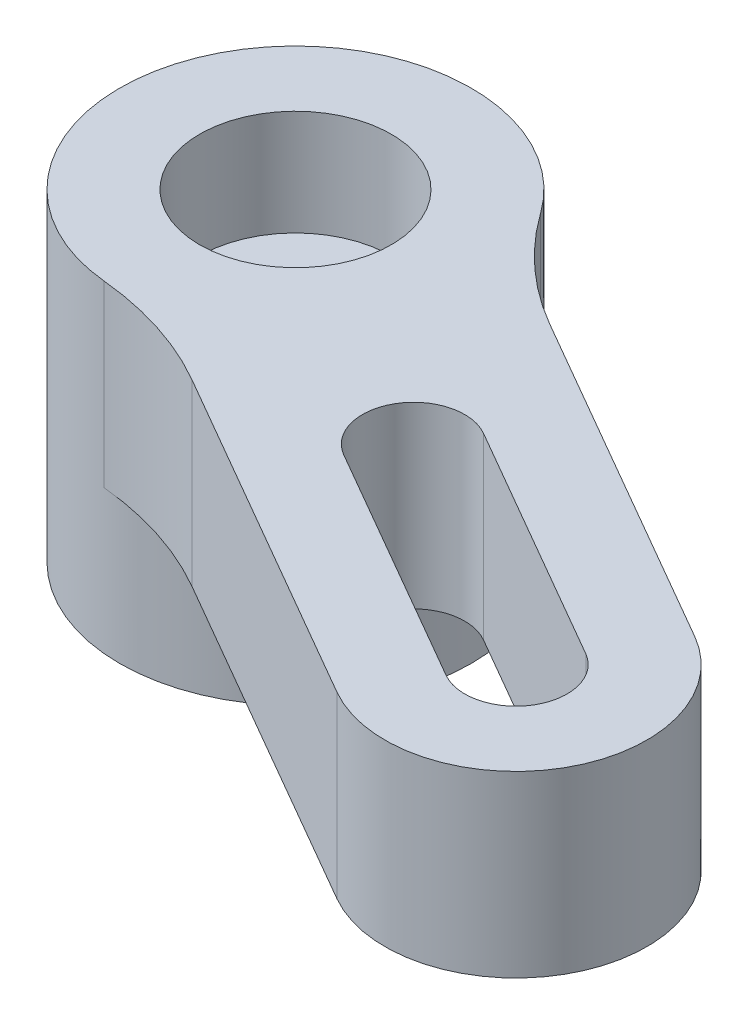
from build123d import *

# Parameters (mm, degrees)
EXTRUDE_THIN2_DEPTH = 5.6
BOSS_EXTRUDE1_DEPTH = 5.6
BOSS_EXTRUDE2_START = -4.5
SKETCH6_R           = 5.5
BOSS_EXTRUDE2_DEPTH = 10.1
FILLET1_R           = 10
SKETCH7_R           = 2.59
CUT_EXTRUDE3_DEPTH  = 4
CUT_EXTRUDE4_DEPTH  = 4
CIRPATTERN1_COUNT   = 25
SKETCH9_R           = 3
CUT_EXTRUDE5_DEPTH  = 3.3
SKETCH10_R          = 1.6
CUT_EXTRUDE6_DEPTH  = 26.423002314


with BuildPart() as part:
    # Sketch4 → Extrude-Thin2 (new body)
    with BuildSketch(Plane(origin=(0, 0, 0), x_dir=(1, 0, 0), z_dir=(0, 1, 0))):
        with BuildLine():
            Line((10.796856578, -1.499295844), (18.374578861, -5.874295844))
            ThreePointArc((18.374578861, -5.874295844), (19.875283017, -11.475), (14.274578861, -12.975704156))
            Line((14.274578861, -12.975704156), (6.696856578, -8.600704156))
            ThreePointArc((6.696856578, -8.600704156), (5.196152423, -3), (10.796856578, -1.499295844))
        make_face()
        with BuildLine():
            Line((9.546856578, -3.664359354), (17.124578861, -8.039359354))
            ThreePointArc((17.124578861, -8.039359354), (17.710219507, -10.225), (15.524578861, -10.810640646))
            Line((15.524578861, -10.810640646), (7.946856578, -6.435640646))
            ThreePointArc((7.946856578, -6.435640646), (7.361215932, -4.25), (9.546856578, -3.664359354))
        make_face(mode=Mode.SUBTRACT)
    extrude(amount=EXTRUDE_THIN2_DEPTH)

    # Sketch5 → Boss-Extrude1 (add)
    with BuildSketch(Plane(origin=(0, 0, 0), x_dir=(1, 0, 0), z_dir=(0, 1, 0))):
        with BuildLine():
            Line((10.796856578, -1.499295844), (2.05, 3.550704156))
            ThreePointArc((2.05, 3.550704156), (-3.550704156, 2.05), (-2.05, -3.550704156))
            Line((-2.05, -3.550704156), (6.696856578, -8.600704156))
            ThreePointArc((6.696856578, -8.600704156), (8.998238507, -9.142286296), (11.216030786, -8.323099255))
            Line((11.216030786, -8.323099255), (7.946856578, -6.435640646))
            ThreePointArc((7.946856578, -6.435640646), (7.361215932, -4.25), (9.546856578, -3.664359354))
            Line((9.546856578, -3.664359354), (12.816030786, -5.551817963))
            ThreePointArc((12.816030786, -5.551817963), (12.416571434, -3.221559989), (10.796856578, -1.499295844))
        make_face()
    extrude(amount=BOSS_EXTRUDE1_DEPTH)

    # Sketch6 → Boss-Extrude2 (add)
    with BuildSketch(Plane(origin=(0, 0, 0), x_dir=(1, 0, 0), z_dir=(0, 1, 0)).offset(BOSS_EXTRUDE2_START)):
        with Locations(Location((0, 0, 0), (0, 0, 270))):
            Circle(SKETCH6_R)
    extrude(amount=BOSS_EXTRUDE2_DEPTH)

    # Fillet1
    # the kernel refuses this fillet: 10 mm, written as the material it adds along each edge
    with BuildSketch(Plane(origin=(1.124901573, 5.6, 5.383734433), x_dir=(-0.998469356889102, 0, 0.05530771513507689), z_dir=(0, -1, 0))) as fillet1_piece_1:
        with BuildLine():
            CenterArc((3.151594855, -9.886744715), FILLET1_R, 98.631327733, 24.539188727)
            Line((-2.319730793, -1.516285011), (0, 0))
            ThreePointArc((0, 0), (0.8254177, -0.062290407), (1.6508354, 0))
        make_face()
    extrude(amount=5.6)
    with BuildSketch(Plane(origin=(5.224901573, 5.6, -1.717673878), x_dir=(0.8660254037844397, 0, 0.49999999999999806), z_dir=(0, -1, 0))) as fillet1_piece_2:
        with BuildLine():
            CenterArc((2.77133022, -10), FILLET1_R, 90, 24.539188727)
            ThreePointArc((-1.381825119, -0.903225806), (-0.65683145, -0.503752837), (0, 0))
            Line((0, 0), (2.77133022, 0))
        make_face()
    extrude(amount=5.6)

    # Sketch7 → Cut-Extrude3 (cut)
    with BuildSketch(Plane.XZ.offset(4.5)):
        with Locations(Location((0, 0, 0), (0, 0, 270))):
            Circle(SKETCH7_R)
    extrude(amount=-CUT_EXTRUDE3_DEPTH, mode=Mode.SUBTRACT)

    # Sketch8 → Cut-Extrude4 (cut)
    with BuildSketch(Plane.XZ.offset(4.5)):
        with BuildLine():
            Line((0, 3.04), (0, 2.59))
            ThreePointArc((0, 2.59), (0.162627446, 2.584889227), (0.324613075, 2.569577076))
            Line((0.324613075, 2.569577076), (0.15, 3.04))
            Line((0.15, 3.04), (0, 3.04))
        make_face()
        with BuildLine():
            ThreePointArc((-0.324613075, 2.569577076), (-0.162627446, 2.584889227), (0, 2.59))
            Line((0, 2.59), (0, 3.04))
            Line((0, 3.04), (-0.15, 3.04))
            Line((-0.15, 3.04), (-0.324613075, 2.569577076))
        make_face()
    cut_extrude4 = extrude(amount=-CUT_EXTRUDE4_DEPTH, mode=Mode.SUBTRACT)

    # CirPattern1: Cut-Extrude4 ×25 about axis
    cirpattern1_axis = Axis((0, 0, 0), (0, 1, 0))
    for i in range(1, CIRPATTERN1_COUNT):
        add(cut_extrude4.rotate(cirpattern1_axis, i * 360 / CIRPATTERN1_COUNT), mode=Mode.SUBTRACT)

    # Sketch9 → Cut-Extrude5 (cut)
    with BuildSketch(Plane(origin=(0, 5.6, 0), x_dir=(1, 0, 0), z_dir=(0, 1, 0))):
        with Locations(Location((0, 0, 0), (0, 0, 270))):
            Circle(SKETCH9_R)
    extrude(amount=-CUT_EXTRUDE5_DEPTH, mode=Mode.SUBTRACT)

    # Sketch10 → Cut-Extrude6 (cut, through all)
    with BuildSketch(Plane(origin=(0, 2.3, 0), x_dir=(1, 0, 0), z_dir=(0, 1, 0))):
        with Locations(Location((0, 0, 0), (0, 0, 270))):
            Circle(SKETCH10_R)
    extrude(amount=-CUT_EXTRUDE6_DEPTH, mode=Mode.SUBTRACT)


solid = part.part
